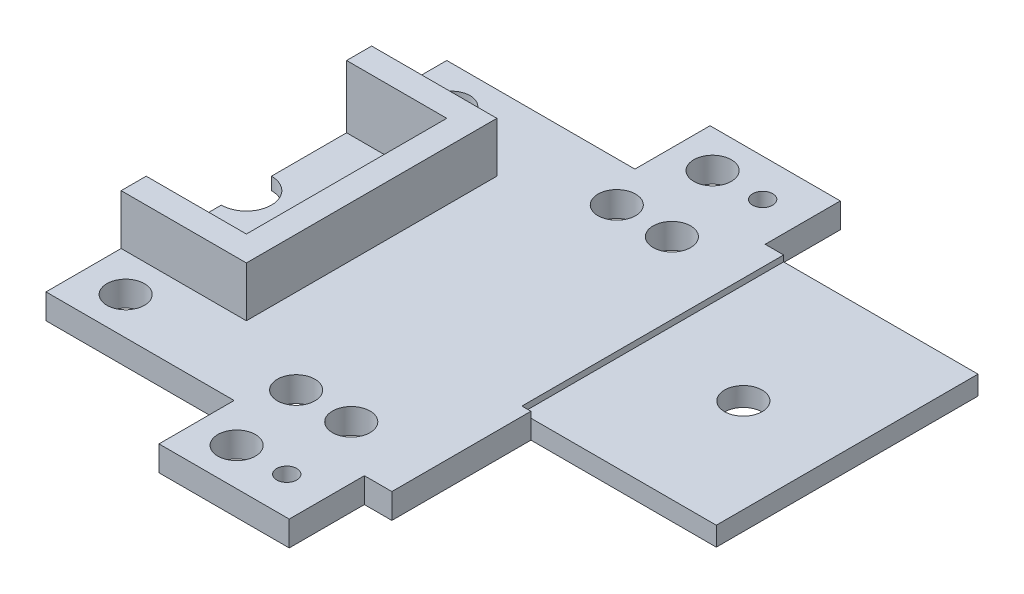
from build123d import *

# Parameters (mm, degrees)
SKETCH1_W                 = 279.4
SKETCH1_H                 = 101.6
BOSS_EXTRUDE1_DEPTH       = 6.35
SKETCH2_R                 = 13.97
BOSS_EXTRUDE3_DEPTH       = 5.55625
SKETCH9_R                 = 11.1125
CUT_EXTRUDE4_DEPTH        = 4.445
CUT_EXTRUDE5_START        = -5.55625
SKETCH10_R                = 11.1125
CUT_EXTRUDE5_DEPTH        = 5.55625
SKETCH11_R                = 7.9375
CUT_EXTRUDE6_DEPTH        = 285.078633923
SKETCH12_R                = 6.35
CUT_EXTRUDE7_DEPTH        = 285.051619429
SKETCH22_W                = 63.5
SKETCH22_H                = 63.5
BOSS_EXTRUDE7_DEPTH       = 12.7
SKETCH25_W                = 50.8
SKETCH25_H                = 50.8
CUT_EXTRUDE11_DEPTH       = 15.875
SKETCH32_R                = 4.7625
CUT_EXTRUDE12_DEPTH       = 6.35
SKETCH38_W                = 46.99
SKETCH38_H                = 18.470251096
CUT_EXTRUDE13_DEPTH       = 6.35
SKETCH60_R                = 4.7625
CUT_EXTRUDE23_DEPTH       = 6.35
SKETCH64_R                = 4.7625
CUT_EXTRUDE24_DEPTH       = 285.264471927
SKETCH69_W                = 33.02
SKETCH69_H                = 6.35
BOSS_EXTRUDE10_DEPTH      = 19.05
SKETCH70_R                = 4.7625
SKETCH70_R_2              = 2.54
CUT_EXTRUDE26_DEPTH       = 6.35
SKETCH76_R                = 4.7625
CUT_EXTRUDE29_DEPTH       = 6.35
SKETCH77_W                = 46.99
SKETCH77_H                = 16.7871648
CUT_EXTRUDE30_DEPTH       = 6.35
SKETCH78_W                = 49.276
SKETCH78_H                = 66.342584104
CUT_EXTRUDE32_DEPTH       = 1.524
SKETCH79_R                = 4.7625
CUT_EXTRUDE33_DEPTH       = 4.826
CUT_EXTRUDE34_START       = -3.175
CUT_EXTRUDE34_OUTLINE_R   = 4.7625
CUT_EXTRUDE34_OUTLINE_R_2 = 7.9375
CUT_EXTRUDE34_DEPTH       = 19.05


# Read off the part's stored shape, not the designer's step: Cut-Extrude34
with BuildPart() as part:
    # Sketch1 → Boss-Extrude1 (new body)
    with BuildSketch(Plane(origin=(0, 0, 0), x_dir=(1, 0, 0), z_dir=(0, 1, 0))):
        with Locations((-139.7, 0)):
            Rectangle(SKETCH1_W, SKETCH1_H)
    extrude(amount=BOSS_EXTRUDE1_DEPTH)

    # Sketch2 → Boss-Extrude3 (add)
    with BuildSketch(Plane(origin=(0, 6.35, 0), x_dir=(1, 0, 0), z_dir=(0, 1, 0))):
        with Locations(Location((-258.510557857, 0, 0), (0, 0, 90))):
            Circle(SKETCH2_R)
    extrude(amount=BOSS_EXTRUDE3_DEPTH)

    # Sketch9 → Cut-Extrude4 (cut)
    with BuildSketch(Plane(origin=(0, 11.90625, 0), x_dir=(1, 0, 0), z_dir=(0, 1, 0))):
        with Locations(Location((-258.510557857, 0, 0), (0, 0, 270))):
            Circle(SKETCH9_R)
    extrude(amount=-CUT_EXTRUDE4_DEPTH, mode=Mode.SUBTRACT)

    # Sketch10 → Cut-Extrude5 (cut)
    with BuildSketch(Plane(origin=(0, 0, 0), x_dir=(-1, 0, 0), z_dir=(0, -1, 0)).offset(CUT_EXTRUDE5_START)):
        with Locations(Location((258.510557857, 0, 0), (0, 0, 270))):
            Circle(SKETCH10_R)
    extrude(amount=CUT_EXTRUDE5_DEPTH, mode=Mode.SUBTRACT)

    # Sketch11 → Cut-Extrude6 (cut, through all)
    with BuildSketch(Plane(origin=(0, 7.46125, 0), x_dir=(1, 0, 0), z_dir=(0, 1, 0))):
        with Locations(Location((-258.510557857, 0, 0), (0, 0, 270))):
            Circle(SKETCH11_R)
    extrude(amount=-CUT_EXTRUDE6_DEPTH, mode=Mode.SUBTRACT)

    # Sketch12 → Cut-Extrude7 (cut, through all)
    with BuildSketch(Plane(origin=(0, 6.35, 0), x_dir=(1, 0, 0), z_dir=(0, 1, 0))):
        with Locations(Location((-134.666203771, 0, 0), (0, 0, 270))):
            Circle(SKETCH12_R)
    extrude(amount=-CUT_EXTRUDE7_DEPTH, mode=Mode.SUBTRACT)

    # Sketch22 → Boss-Extrude7 (add)
    with BuildSketch(Plane(origin=(0, 6.35, 0), x_dir=(1, 0, 0), z_dir=(0, 1, 0))):
        with Locations((-134.666203771, 0)):
            Rectangle(SKETCH22_W, SKETCH22_H)
    extrude(amount=BOSS_EXTRUDE7_DEPTH)

    # Sketch25 → Cut-Extrude11 (cut)
    with BuildSketch(Plane(origin=(0, 19.05, 0), x_dir=(1, 0, 0), z_dir=(0, 1, 0))):
        with Locations((-134.666203771, 0)):
            Rectangle(SKETCH25_W, SKETCH25_H)
    extrude(amount=-CUT_EXTRUDE11_DEPTH, mode=Mode.SUBTRACT)

    # Sketch32 → Cut-Extrude12 (cut)
    with BuildSketch(Plane(origin=(0, 6.35, 0), x_dir=(1, 0, 0), z_dir=(0, 1, 0))):
        with Locations(Location((-67.44195898, -40.64, 0), (0, 0, 270))):
            Circle(SKETCH32_R)
        with Locations(Location((-81.41195898, -40.64, 0), (0, 0, 270))):
            Circle(SKETCH32_R)
        with Locations(Location((-67.44195898, 40.64, 0), (0, 0, 270))):
            Circle(SKETCH32_R)
        with Locations(Location((-81.41195898, 40.64, 0), (0, 0, 270))):
            Circle(SKETCH32_R)
    extrude(amount=-CUT_EXTRUDE12_DEPTH, mode=Mode.SUBTRACT)

    # Sketch38 → Cut-Extrude13 (cut)
    with BuildSketch(Plane(origin=(0, 6.35, 0), x_dir=(1, 0, 0), z_dir=(0, 1, 0))):
        with Locations((-23.495, -24.777709652)):
            Rectangle(SKETCH38_W, SKETCH38_H)
    extrude(amount=-CUT_EXTRUDE13_DEPTH, mode=Mode.SUBTRACT)

    # Sketch60 → Cut-Extrude23 (cut)
    with BuildSketch(Plane(origin=(0, 6.35, 0), x_dir=(1, 0, 0), z_dir=(0, 1, 0))):
        with Locations(Location((-231.7492444, 41.324145444, 0), (0, 0, 270))):
            Circle(SKETCH60_R)
        with Locations(Location((-231.7492444, -39.369341378, 0), (0, 0, 270))):
            Circle(SKETCH60_R)
        with Locations(Location((-173.509244294, -39.369341378, 0), (0, 0, 270))):
            Circle(SKETCH60_R)
        with Locations(Location((-173.509244294, 41.324145444, 0), (0, 0, 270))):
            Circle(SKETCH60_R)
    extrude(amount=-CUT_EXTRUDE23_DEPTH, mode=Mode.SUBTRACT)

    # Sketch64 → Cut-Extrude24 (cut, through all)
    with BuildSketch(Plane(origin=(0, 6.35, 0), x_dir=(1, 0, 0), z_dir=(0, 1, 0))):
        with Locations(Location((-145.334203771, -41.275, 0), (0, 0, 270))):
            Circle(SKETCH64_R)
        with Locations(Location((-123.998203771, -41.275, 0), (0, 0, 270))):
            Circle(SKETCH64_R)
    cut_extrude24 = extrude(amount=-CUT_EXTRUDE24_DEPTH, mode=Mode.SUBTRACT)

    # Mirror1: Cut-Extrude24 across plane
    add(cut_extrude24.mirror(Plane.XY), mode=Mode.SUBTRACT)

    # Sketch69 → Boss-Extrude10 (add)
    with BuildSketch(Plane.XY.offset(50.8)):
        with Locations((-70.465355554, 3.175)):
            Rectangle(SKETCH69_W, SKETCH69_H)
    boss_extrude10 = extrude(amount=BOSS_EXTRUDE10_DEPTH)

    # Sketch70 → Cut-Extrude26 (cut)
    with BuildSketch(Plane(origin=(0, 6.35, 0), x_dir=(1, 0, 0), z_dir=(0, 1, 0))):
        with Locations(Location((-76.815355554, -60.325, 0), (0, 0, 270))):
            Circle(SKETCH70_R)
        with Locations(Location((-64.115355554, -60.325, 0), (0, 0, 270))):
            Circle(SKETCH70_R_2)
    cut_extrude26 = extrude(amount=-CUT_EXTRUDE26_DEPTH, mode=Mode.SUBTRACT)

    # Mirror2: Boss-Extrude10, Cut-Extrude26 across plane
    add(boss_extrude10.mirror(Plane.XY))
    add(cut_extrude26.mirror(Plane.XY), mode=Mode.SUBTRACT)

    # Sketch76 → Cut-Extrude29 (cut)
    with BuildSketch(Plane(origin=(0, 6.35, 0), x_dir=(1, 0, 0), z_dir=(0, 1, 0))):
        with Locations(Location((-264.668, 24.13, 0), (0, 0, 270))):
            Circle(SKETCH76_R)
        with Locations(Location((-252.222, 24.13, 0), (0, 0, 270))):
            Circle(SKETCH76_R)
    extrude(amount=-CUT_EXTRUDE29_DEPTH, mode=Mode.SUBTRACT)

    # Sketch77 → Cut-Extrude30 (cut)
    with BuildSketch(Plane(origin=(0, 6.35, 0), x_dir=(1, 0, 0), z_dir=(0, 1, 0))):
        with Locations((-23.495, -42.4064176)):
            Rectangle(SKETCH77_W, SKETCH77_H)
    extrude(amount=-CUT_EXTRUDE30_DEPTH, mode=Mode.SUBTRACT)

    # Sketch78 → Cut-Extrude32 (cut)
    with BuildSketch(Plane(origin=(0, 6.35, 0), x_dir=(1, 0, 0), z_dir=(0, 1, 0))):
        with Locations((-24.638, 17.628707948)):
            Rectangle(SKETCH78_W, SKETCH78_H)
    extrude(amount=-CUT_EXTRUDE32_DEPTH, mode=Mode.SUBTRACT)

    # Sketch79 → Cut-Extrude33 (cut)
    with BuildSketch(Plane(origin=(0, 4.826, 0), x_dir=(1, 0, 0), z_dir=(0, 1, 0))):
        with Locations(Location((-23.876, 15.191415896, 0), (0, 0, 270))):
            Circle(SKETCH79_R)
    extrude(amount=-CUT_EXTRUDE33_DEPTH, mode=Mode.SUBTRACT)

    # Cut-Extrude34 outline → Cut-Extrude34 (cut)
    with BuildSketch(Plane(origin=(0, 3.175, 0), x_dir=(1, 0, 0), z_dir=(0, 1, 0)).offset(CUT_EXTRUDE34_START)):
        with BuildLine():
            ThreePointArc((-134.666203771, -6.35), (-141.016203771, 0), (-134.666203771, 6.35))
            Line((-134.666203771, 6.35), (-134.666203771, 50.8))
            Line((-134.666203771, 50.8), (-279.4, 50.8))
            Line((-279.4, 50.8), (-279.4, -50.8))
            Line((-279.4, -50.8), (-134.666203771, -50.8))
            Line((-134.666203771, -50.8), (-134.666203771, -6.35))
        make_face()
        with Locations((-231.7492444, 41.324145444)):
            Circle(CUT_EXTRUDE34_OUTLINE_R, mode=Mode.SUBTRACT)
        with Locations((-173.509244294, 41.324145444)):
            Circle(CUT_EXTRUDE34_OUTLINE_R, mode=Mode.SUBTRACT)
        with Locations((-145.334203771, 41.275)):
            Circle(CUT_EXTRUDE34_OUTLINE_R, mode=Mode.SUBTRACT)
        with Locations((-231.7492444, -39.369341378)):
            Circle(CUT_EXTRUDE34_OUTLINE_R, mode=Mode.SUBTRACT)
        with Locations((-173.509244294, -39.369341378)):
            Circle(CUT_EXTRUDE34_OUTLINE_R, mode=Mode.SUBTRACT)
        with Locations((-145.334203771, -41.275)):
            Circle(CUT_EXTRUDE34_OUTLINE_R, mode=Mode.SUBTRACT)
        with Locations((-264.668, 24.13)):
            Circle(CUT_EXTRUDE34_OUTLINE_R, mode=Mode.SUBTRACT)
        with Locations((-252.222, 24.13)):
            Circle(CUT_EXTRUDE34_OUTLINE_R, mode=Mode.SUBTRACT)
        with Locations((-258.510557857, 0)):
            Circle(CUT_EXTRUDE34_OUTLINE_R_2, mode=Mode.SUBTRACT)
    extrude(amount=CUT_EXTRUDE34_DEPTH, mode=Mode.SUBTRACT)


solid = part.part
